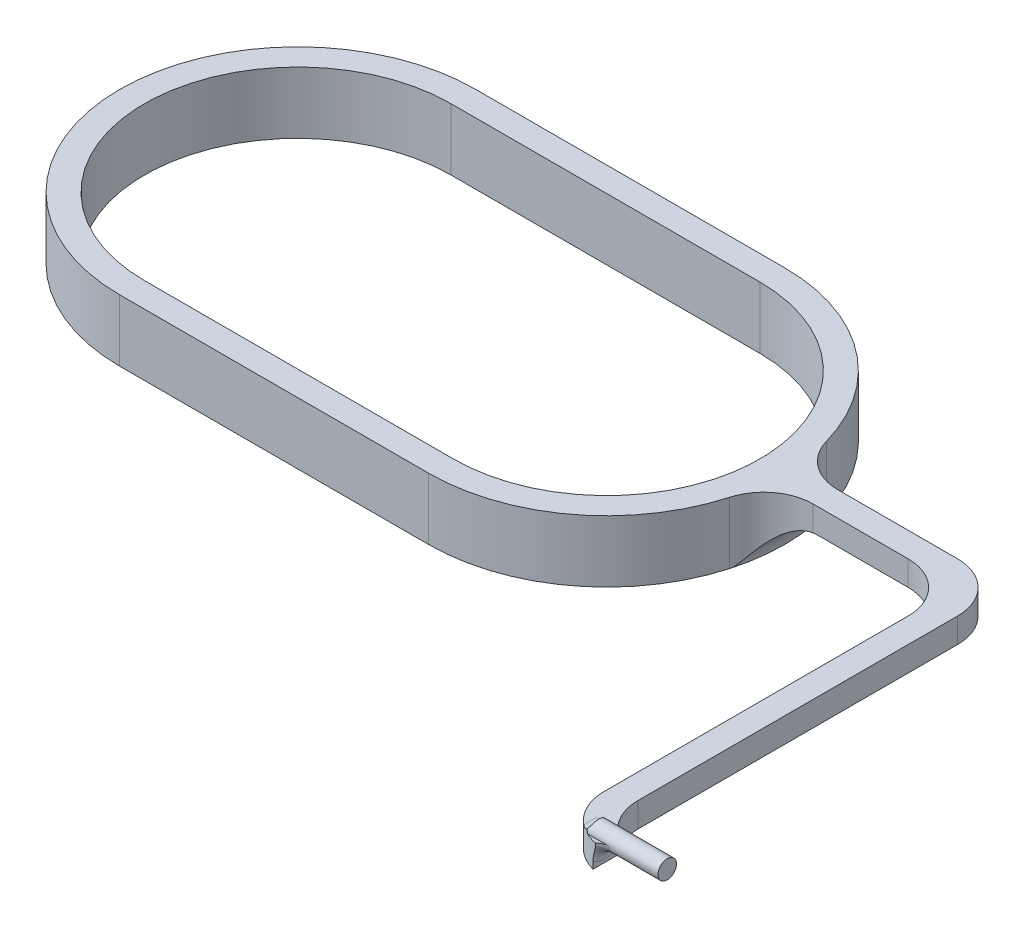
from build123d import *

# Parameters (mm, degrees)
BOSS_EXTRUDE1_DEPTH      = 5
BOSS_EXTRUDE2_START      = 2
SKETCH2_W                = 2
SKETCH2_H                = 2
SKETCH2_H_2              = 30.5
SKETCH2_W_2              = 1
BOSS_EXTRUDE2_DEPTH      = 2
FILLET1_R                = 4
BOSS_EXTRUDE3_DEPTH      = 5
BOSS_EXTRUDE3_DEPTH_BACK = 0.5
SKETCH3_R                = 0.75
FILLET2_R                = 1


with BuildPart() as part:
    # Sketch1 → Boss-Extrude1 (new body)
    with BuildSketch(Plane(origin=(0, 0, 0), x_dir=(1, 0, 0), z_dir=(0, 1, 0))):
        with BuildLine():
            Line((0, 14.4), (25, 14.4))
            ThreePointArc((25, 14.4), (39.4, 0), (25, -14.4))
            Line((25, -14.4), (0, -14.4))
            ThreePointArc((0, -14.4), (-14.4, 0), (0, 14.4))
        make_face()
        with BuildLine():
            Line((0, 12.4), (25, 12.4))
            ThreePointArc((25, 12.4), (37.4, 0), (25, -12.4))
            Line((25, -12.4), (0, -12.4))
            ThreePointArc((0, -12.4), (-12.4, 0), (0, 12.4))
        make_face(mode=Mode.SUBTRACT)
    extrude(amount=BOSS_EXTRUDE1_DEPTH)

    # Sketch2 → Boss-Extrude2 (add)
    with BuildSketch(Plane.XZ.offset(-5).offset(BOSS_EXTRUDE2_START)):
        with BuildLine():
            Line((39.365235814, -1), (54.4, -1))
            Line((54.4, -1), (54.4, 1))
            Line((54.4, 1), (39.365235814, 1))
            ThreePointArc((39.365235814, 1), (39.4, 0), (39.365235814, -1))
        make_face()
        with BuildLine():
            Line((37.4, -1), (39.365235814, -1))
            ThreePointArc((39.365235814, -1), (39.4, 0), (39.365235814, 1))
            Line((39.365235814, 1), (37.4, 1))
            Line((37.4, 1), (37.4, -1))
        make_face()
        with Locations((55.4, 0)):
            Rectangle(SKETCH2_W, SKETCH2_H)
        with Locations((55.4, 16.25)):
            Rectangle(SKETCH2_W, SKETCH2_H_2)
        with Locations((55.4, 32.5)):
            Rectangle(SKETCH2_W, SKETCH2_H)
        with Locations((56.9, 32.5)):
            Rectangle(SKETCH2_W_2, SKETCH2_H)
    extrude(amount=-BOSS_EXTRUDE2_DEPTH)

    # Fillet1
    # the kernel refuses this fillet: 4 mm, written as the material it adds along each edge
    with BuildSketch(Plane(origin=(25, 3, 0), x_dir=(0.7371891614816782, 0, -0.6756864214959037), z_dir=(-0.6756864214959037, 0, -0.7371891614816782))) as fillet1_piece_1_section:
        with BuildLine():
            CenterArc((18.272983346, 4), FILLET1_R, 194.477512186, 75.522487814)
            Line((18.272983346, 0), (18.272983346, -0.08))
            Line((18.272983346, -0.08), (14.4, -0.08))
            Line((14.4, -0.08), (14.32, 0))
            ThreePointArc((14.32, 0), (14.32, 1.5), (14.322540333, 2.98))
            Line((14.322540333, 2.98), (14.4, 3))
        make_face()
    fillet1_piece_1 = revolve(axis=Axis((25, 3, 0), (0, -1, 0)), revolution_arc=85.014954966, mode=Mode.PRIVATE)
    fillet1_piece_1 = split(fillet1_piece_1, bisect_by=Plane(origin=(40.301586348, 2.241602013, 1), z_dir=(0, 0, -1)), keep=Keep.TOP, mode=Mode.PRIVATE)
    fillet1_piece_1 = split(fillet1_piece_1, bisect_by=Plane(origin=(40.301586348, 2.241602013, -1), z_dir=(0, 0, 1)), keep=Keep.TOP, mode=Mode.PRIVATE)
    add(fillet1_piece_1)
    with BuildSketch(Plane(origin=(39.365235814, 5, 1), x_dir=(-0.17149804582148107, 0, 0.9851844600273663), z_dir=(0, -1, 0))) as fillet1_piece_2:
        with BuildLine():
            CenterArc((3.367524545, -3.978862537), FILLET1_R, 95.892851455, 74.232218513)
            Line((-0.573213295, -3.292870354), (-0.652028052, -3.27915051))
            Line((-0.652028052, -3.27915051), (-0.078814757, 0.013719844))
            Line((-0.078814757, 0.013719844), (0.008213474, 0.079577251))
            ThreePointArc((0.008213474, 0.079577251), (1.47842541, 0.003905135), (2.948637345, 0.079577251))
            Line((2.948637345, 0.079577251), (2.95685082, 0))
        make_face()
    extrude(amount=2)
    with BuildSketch(Plane(origin=(39.365235814, 5, -1), x_dir=(-0.17149804582148342, 0, -0.9851844600273658), z_dir=(0, -1, 0))) as fillet1_piece_3:
        with BuildLine():
            CenterArc((3.367524545, 3.978862537), FILLET1_R, 189.874930032, 74.232218513)
            Line((-0.573213295, 3.292870354), (-0.652028052, 3.27915051))
            Line((-0.652028052, 3.27915051), (-0.078814757, -0.013719844))
            Line((-0.078814757, -0.013719844), (0.008213474, -0.079577251))
            ThreePointArc((0.008213474, -0.079577251), (1.47842541, -0.003905135), (2.948637345, -0.079577251))
            Line((2.948637345, -0.079577251), (2.95685082, 0))
        make_face()
    extrude(amount=2)
    with BuildSketch(Plane(origin=(54.4, 3, 1), x_dir=(-1, 0, 0), z_dir=(0, 1, 0))) as fillet1_piece_4:
        with BuildLine():
            CenterArc((FILLET1_R, FILLET1_R), FILLET1_R, 180, 90)
            Line((0, FILLET1_R), (-FILLET1_R * 0.02, FILLET1_R))
            Line((-FILLET1_R * 0.02, FILLET1_R), (-FILLET1_R * 0.02, -FILLET1_R * 0.02))
            Line((-FILLET1_R * 0.02, -FILLET1_R * 0.02), (FILLET1_R, -FILLET1_R * 0.02))
            Line((FILLET1_R, -FILLET1_R * 0.02), (FILLET1_R, 0))
        make_face()
    extrude(amount=2)
    with BuildSketch(Plane(origin=(56.4, 3, 31.5), x_dir=(1, 0, 0), z_dir=(0, 1, 0))) as fillet1_piece_5:
        with BuildLine():
            CenterArc((4, 2.645751311), FILLET1_R, 180, 41.409622109)
            Line((0, 2.645751311), (-0.08, 2.645751311))
            Line((-0.08, 2.645751311), (-0.08, 0))
            Line((-0.08, 0), (0, -0.08))
            ThreePointArc((0, -0.08), (0.5, -0.08), (0.94, -0.052915026))
            Line((0.94, -0.052915026), (1, 0))
        make_face()
    extrude(amount=2)
    with BuildSketch(Plane(origin=(25, 3, 0), x_dir=(0.7371891614816782, 0, -0.6756864214959037), z_dir=(-0.6756864214959037, 0, -0.7371891614816782))) as fillet1_piece_6a_section:
        with BuildLine():
            CenterArc((18.272983346, 4), FILLET1_R, 194.477512186, 75.522487814)
            Line((18.272983346, 0), (18.272983346, -0.08))
            Line((18.272983346, -0.08), (14.4, -0.08))
            Line((14.4, -0.08), (14.32, 0))
            ThreePointArc((14.32, 0), (14.32, 1.5), (14.322540333, 2.98))
            Line((14.322540333, 2.98), (14.4, 3))
        make_face()
    fillet1_piece_6a = revolve(axis=Axis((25, 3, 0), (0, -1, 0)), revolution_arc=85.014954966, mode=Mode.PRIVATE)
    fillet1_piece_6a = split(fillet1_piece_6a, bisect_by=Plane(origin=(38.861424428, 2.266551756, -1), z_dir=(0, 0, -1)), keep=Keep.TOP, mode=Mode.PRIVATE)
    with BuildSketch(Plane(origin=(39.365235814, 5, -1), x_dir=(-0.17149804582148342, 0, -0.9851844600273658), z_dir=(0, -1, 0))) as fillet1_piece_6b_section:
        with BuildLine():
            CenterArc((3.367524545, 3.978862537), FILLET1_R, 189.874930032, 74.232218513)
            Line((-0.573213295, 3.292870354), (-0.652028052, 3.27915051))
            Line((-0.652028052, 3.27915051), (-0.078814757, -0.013719844))
            Line((-0.078814757, -0.013719844), (0.008213474, -0.079577251))
            ThreePointArc((0.008213474, -0.079577251), (1.47842541, -0.003905135), (2.948637345, -0.079577251))
            Line((2.948637345, -0.079577251), (2.95685082, 0))
        make_face()
    fillet1_piece_6b = extrude(amount=10.355974154, mode=Mode.PRIVATE)
    fillet1_piece_6b = split(fillet1_piece_6b, bisect_by=Plane(origin=(40.057221624, 0, -1.646357347), z_dir=(0, 1, 0)), keep=Keep.TOP, mode=Mode.PRIVATE)
    fillet1_piece_6b = split(fillet1_piece_6b, bisect_by=Plane(origin=(40.057221624, 3, -1.646357347), z_dir=(0, -1, 0)), keep=Keep.TOP, mode=Mode.PRIVATE)
    fillet1_piece_6 = fillet1_piece_6a & fillet1_piece_6b
    add(fillet1_piece_6)
    with BuildSketch(Plane(origin=(39.365235814, 5, 1), x_dir=(-0.17149804582148107, 0, 0.9851844600273663), z_dir=(0, -1, 0))) as fillet1_piece_7a_section:
        with BuildLine():
            CenterArc((3.367524545, -3.978862537), FILLET1_R, 95.892851455, 74.232218513)
            Line((-0.573213295, -3.292870354), (-0.652028052, -3.27915051))
            Line((-0.652028052, -3.27915051), (-0.078814757, 0.013719844))
            Line((-0.078814757, 0.013719844), (0.008213474, 0.079577251))
            ThreePointArc((0.008213474, 0.079577251), (1.47842541, 0.003905135), (2.948637345, 0.079577251))
            Line((2.948637345, 0.079577251), (2.95685082, 0))
        make_face()
    fillet1_piece_7a = extrude(amount=10.355974154, mode=Mode.PRIVATE)
    fillet1_piece_7a = split(fillet1_piece_7a, bisect_by=Plane(origin=(40.057221624, 0, 1.646357347), z_dir=(0, 1, 0)), keep=Keep.TOP, mode=Mode.PRIVATE)
    fillet1_piece_7a = split(fillet1_piece_7a, bisect_by=Plane(origin=(40.057221624, 3, 1.646357347), z_dir=(0, -1, 0)), keep=Keep.TOP, mode=Mode.PRIVATE)
    with BuildSketch(Plane(origin=(25, 3, 0), x_dir=(0.7371891614816782, 0, -0.6756864214959037), z_dir=(-0.6756864214959037, 0, -0.7371891614816782))) as fillet1_piece_7b_section:
        with BuildLine():
            CenterArc((18.272983346, 4), FILLET1_R, 194.477512186, 75.522487814)
            Line((18.272983346, 0), (18.272983346, -0.08))
            Line((18.272983346, -0.08), (14.4, -0.08))
            Line((14.4, -0.08), (14.32, 0))
            ThreePointArc((14.32, 0), (14.32, 1.5), (14.322540333, 2.98))
            Line((14.322540333, 2.98), (14.4, 3))
        make_face()
    fillet1_piece_7b = revolve(axis=Axis((25, 3, 0), (0, -1, 0)), revolution_arc=85.014954966, mode=Mode.PRIVATE)
    fillet1_piece_7b = split(fillet1_piece_7b, bisect_by=Plane(origin=(38.861423807, 2.266551545, 1), z_dir=(0, 0, 1)), keep=Keep.TOP, mode=Mode.PRIVATE)
    fillet1_piece_7 = fillet1_piece_7a & fillet1_piece_7b
    add(fillet1_piece_7)
    # the kernel refuses this fillet: 4 mm, written as the material it takes off along each edge
    with BuildSketch(Plane(origin=(56.4, -7, -1), x_dir=(0, 0, 1), z_dir=(0, 1, 0))) as fillet1_2_piece_1:
        with BuildLine():
            CenterArc((FILLET1_R, -FILLET1_R), FILLET1_R, 90, 90)
            Line((0, -FILLET1_R), (-FILLET1_R * 0.02, -FILLET1_R))
            Line((-FILLET1_R * 0.02, -FILLET1_R), (-FILLET1_R * 0.02, FILLET1_R * 0.02))
            Line((-FILLET1_R * 0.02, FILLET1_R * 0.02), (FILLET1_R, FILLET1_R * 0.02))
            Line((FILLET1_R, FILLET1_R * 0.02), (FILLET1_R, 0))
        make_face()
    extrude(amount=22, mode=Mode.SUBTRACT)
    with BuildSketch(Plane(origin=(54.4, -6.682458366, 33.5), x_dir=(0, 0, -1), z_dir=(0, 1, 0))) as fillet1_2_piece_2:
        with BuildLine():
            CenterArc((3.872983346, -4), FILLET1_R, 90, 75.522487814)
            Line((0, -3), (-0.077459667, -2.98))
            ThreePointArc((-0.077459667, -2.98), (-0.08, -1.5), (-0.08, 0))
            Line((-0.08, 0), (0, 0.08))
            Line((0, 0.08), (3.872983346, 0.08))
            Line((3.872983346, 0.08), (3.872983346, 0))
        make_face()
    extrude(amount=21.364916731, mode=Mode.SUBTRACT)

    # Sketch3 → Boss-Extrude3 (add, two sides: drawn at the far end of the back side and taken through both)
    with BuildSketch(Plane(origin=(57.4, 0, 0), x_dir=(0, 0, -1), z_dir=(1, 0, 0)).offset(-BOSS_EXTRUDE3_DEPTH_BACK)):
        with Locations((-32.5, 5)):
            Circle(SKETCH3_R)
    extrude(amount=BOSS_EXTRUDE3_DEPTH + BOSS_EXTRUDE3_DEPTH_BACK)

    # Fillet2
    # the kernel refuses this fillet: 1 mm, written as the material it adds along each edge
    with BuildSketch(Plane(origin=(56.9, 5, 29.25), x_dir=(-1, 0, 0), z_dir=(0, 0, 1))) as fillet2_piece_1_section:
        with BuildLine():
            CenterArc((FILLET2_R, -FILLET2_R), FILLET2_R, 90, 90)
            Line((0, -FILLET2_R), (0, 0))
            Line((0, 0), (FILLET2_R, 0))
        make_face()
    fillet2_piece_1 = extrude(amount=6.5, mode=Mode.PRIVATE)
    fillet2_piece_1 = fillet2_piece_1 & Plane(origin=(58.4, 5.187261993, 29.627016654), x_dir=(0, 0, -1), z_dir=(0, -1, 0)) * Cylinder(4, 17, mode=Mode.PRIVATE)
    fillet2_piece_1 = fillet2_piece_1 & Plane(origin=(56.665651888, 5, 32.5), x_dir=(0, 0, -1), z_dir=(1, 0, 0)) * Cylinder(0.75, 17, mode=Mode.PRIVATE)
    add(fillet2_piece_1)
    with BuildSketch(Plane(origin=(57.4, 5, 32.5), x_dir=(0, 0, 1), z_dir=(0, 1, 0))) as fillet2_piece_2_section:
        with BuildLine():
            CenterArc((0.75 + FILLET2_R, FILLET2_R), FILLET2_R, 180, 90)
            Line((0.75, FILLET2_R), (0.75, 0))
            Line((0.75, 0), (0.75 + FILLET2_R, 0))
        make_face()
    fillet2_piece_2 = revolve(axis=Axis((57.4, 5, 32.5), (1, 0, 0)), revolution_arc=180, mode=Mode.PRIVATE)
    fillet2_piece_2 = fillet2_piece_2 & Plane(origin=(58.4, 4.254671914, 29.627016654), x_dir=(0, 0, -1), z_dir=(0, -1, 0)) * Cylinder(4, 7, mode=Mode.PRIVATE)
    fillet2_piece_2 = fillet2_piece_2 - Plane(origin=(60.4, 4.254671914, 28.854248689), x_dir=(1, 0, 0), z_dir=(0, -1, 0)) * Cylinder(4, 7, mode=Mode.PRIVATE)
    add(fillet2_piece_2)


solid = part.part
